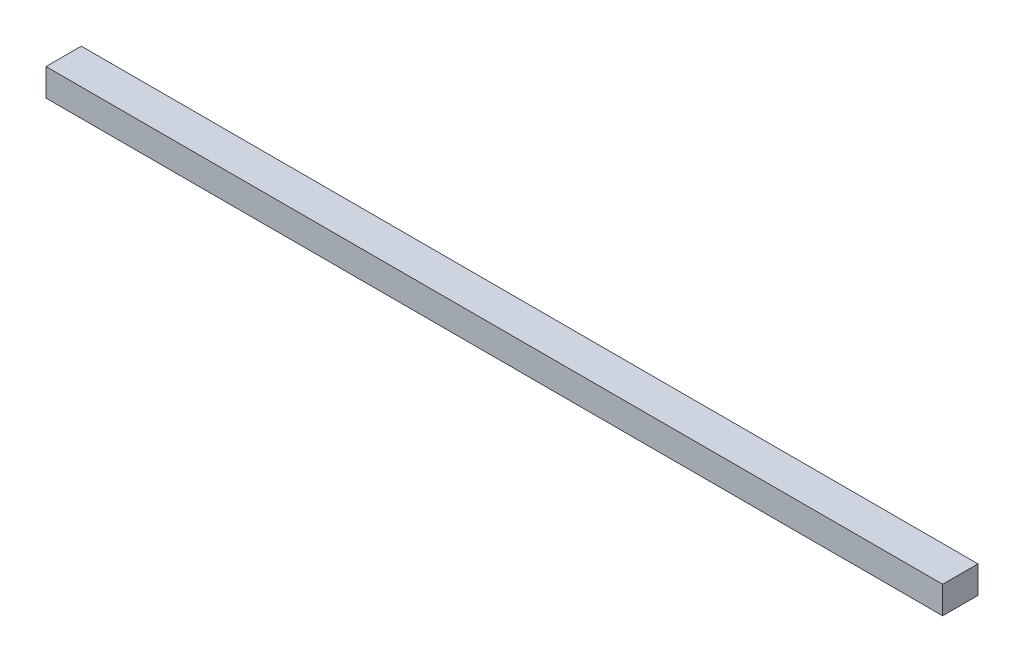
from build123d import *

# Parameters (mm, degrees)
BOSS_EXTRUDE2_START     = -50
BOSS_EXTRUDE2_OUTLINE_W = 3.939378075
BOSS_EXTRUDE2_OUTLINE_H = 3.049171024
BOSS_EXTRUDE2_DEPTH     = 100


# Read off the part's stored shape, not the designer's step: Boss-Extrude2
with BuildPart() as part:
    # Boss-Extrude2 outline → Boss-Extrude2 (new body)
    with BuildSketch(Plane(origin=(0, 0, 0), x_dir=(0, 0, -1), z_dir=(1, 0, 0)).offset(BOSS_EXTRUDE2_START)):
        with Locations((-6.693964747, 0.024585512)):
            Rectangle(BOSS_EXTRUDE2_OUTLINE_W, BOSS_EXTRUDE2_OUTLINE_H)
    extrude(amount=BOSS_EXTRUDE2_DEPTH)


solid = part.part
